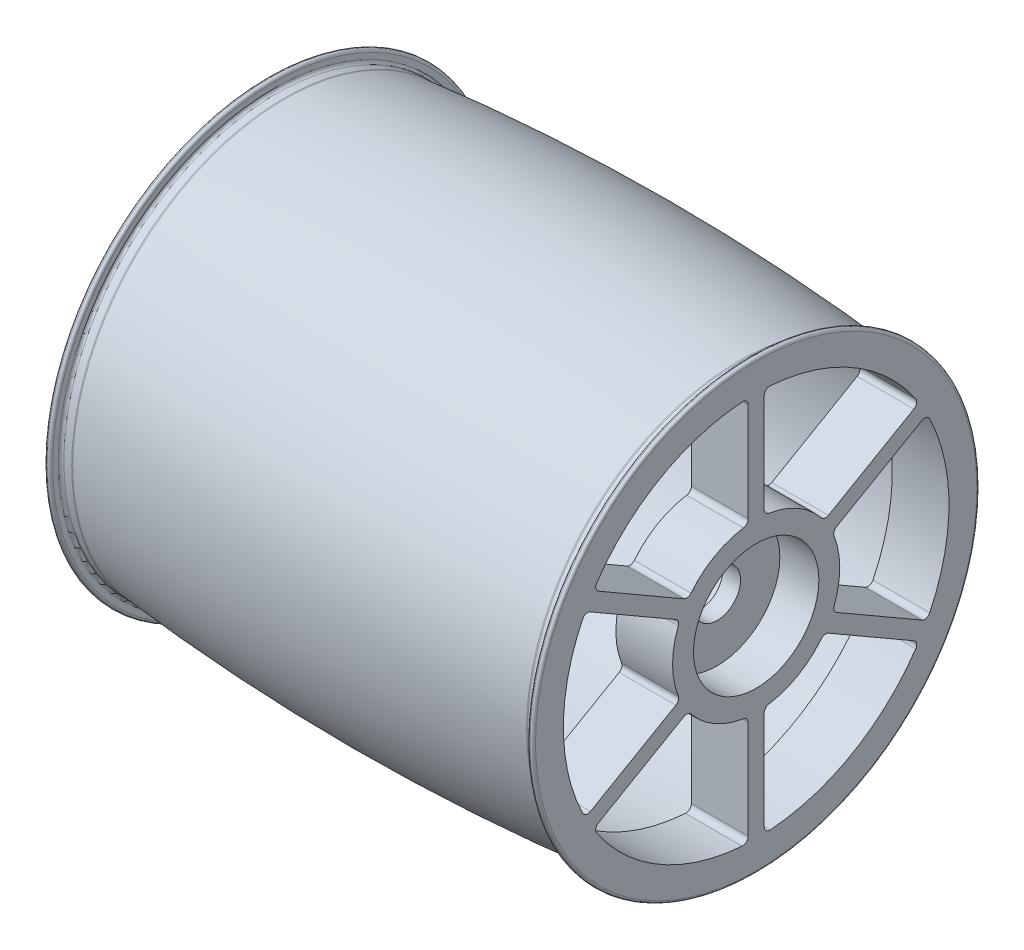
from build123d import *

# Parameters (mm, degrees)
FILLET2_R               = 2
FILLET1_R               = 0.5
CUT_EXTRUDE2_DEPTH      = 105.379293521
CUT_EXTRUDE5_DEPTH      = 105.379293521
CUT_EXTRUDE5_DEPTH_BACK = 105.379293521
SKETCH7_R               = 4.2
SKETCH8_R               = 11.25
CUT_EXTRUDE6_DEPTH      = 7


# Some blends are built 0.0001 mm under size
with BuildPart() as part:
    # Sketch1 → Revolve2 (revolve)
    with BuildSketch(Plane.XY, mode=Mode.PRIVATE) as revolve2_sk:
        with BuildLine():
            Line((-40.815, 38.1), (-42.815, 38.1))
            Line((-42.815, 38.1), (-42.815, 40.1))
            Line((-42.815, 40.1), (-43.815, 40.1))
            Line((-43.815, 40.1), (-43.815, 0))
            Line((-43.815, 0), (-33.64, 0))
            Line((-33.64, 0), (-33.64, 37.739142957))
            ThreePointArc((-33.64, 37.739142957), (0, 39.1), (33.64, 37.739142957))
            Line((33.64, 37.739142957), (33.64, 0))
            Line((33.64, 0), (43.815, 0))
            Line((43.815, 0), (43.815, 40.1))
            Line((43.815, 40.1), (42.815, 40.1))
            Line((42.815, 40.1), (42.815, 38.1))
            Line((42.815, 38.1), (40.815, 38.1))
            ThreePointArc((40.815, 38.1), (0, 40.1), (-40.815, 38.1))
        make_face()
    revolve(revolve2_sk.sketch.rotate(Axis((-40.815, 0, 0), (1, 0, 0)), 90), axis=Axis((-40.815, 0, 0), (1, 0, 0)))

    # Fillet2
    # the kernel refuses this fillet: 2 mm, written as the material it adds along each edge
    with BuildSketch(Plane(origin=(-33.64, 0, 0), x_dir=(0, 0, 1), z_dir=(0, 1, 0))) as fillet2_piece_1:
        with BuildLine():
            CenterArc((35.890549485, 2), FILLET2_R, 270, 85.621827551)
            ThreePointArc((37.884713299, 1.847321635), (37.812955576, 0.923579854), (37.739142957, 0))
            Line((37.739142957, 0), (35.890549485, 0))
        make_face()
    revolve(axis=Axis((-33.64, 0, 0), (1, 0, 0)))
    with BuildSketch(Plane(origin=(33.64, 0, 0), x_dir=(0, 0, 1), z_dir=(0, 1, 0))) as fillet2_piece_2:
        with BuildLine():
            CenterArc((35.890549485, -2), FILLET2_R, 4.378172449, 85.621827551)
            Line((35.890549485, 0), (37.739142957, 0))
            ThreePointArc((37.739142957, 0), (37.812955576, -0.923579854), (37.884713299, -1.847321635))
        make_face()
    revolve(axis=Axis((33.64, 0, 0), (1, 0, 0)))
    with BuildSketch(Plane(origin=(40.815, 0, 0), x_dir=(0, 0, 1), z_dir=(0, 1, 0))) as fillet2_piece_3:
        with BuildLine():
            CenterArc((40.1, 0.097885806), FILLET2_R, 180, 5.597278626)
            ThreePointArc((38.109535933, -0.097185452), (38.104770808, -0.048592447), (38.1, 0))
            Line((38.1, 0), (38.1, 0.097885806))
        make_face()
    revolve(axis=Axis((40.815, 0, 0), (1, 0, 0)))
    with BuildSketch(Plane(origin=(-40.815, 0, 0), x_dir=(0, 0, 1), z_dir=(0, 1, 0))) as fillet2_piece_4:
        with BuildLine():
            CenterArc((40.1, -0.097885806), FILLET2_R, 174.402721374, 5.597278626)
            Line((38.1, -0.097885806), (38.1, 0))
            ThreePointArc((38.1, 0), (38.104770808, 0.048592447), (38.109535933, 0.097185452))
        make_face()
    revolve(axis=Axis((-40.815, 0, 0), (1, 0, 0)))

    # Fillet1
    fillet1_edges = [part.edges().sort_by_distance(p)[0] for p in [
        (-42.815, 0, -40.1),
        (-43.815, 0, -40.1),
        (43.815, 0, -40.1),
        (42.815, 0, -40.1),
        (42.815, 0, -38.1),
        (-42.815, 0, -38.1),
    ]]
    fillet(fillet1_edges, radius=FILLET1_R - 0.0001)  # a hair under: the kernel refuses the full size

    # Sketch2 → Cut-Extrude2 (cut, through all)
    with BuildSketch(Plane.ZY.offset(43.815)):
        with BuildLine():
            Line((14.415571014, 6.656167139), (29.74310125, 15.505520846))
            ThreePointArc((29.74310125, 15.505520846), (30.536893025, 15.595364886), (31.143193549, 15.075194712))
            ThreePointArc((31.143193549, 15.075194712), (34.6, 0), (31.143193549, -15.075194712))
            ThreePointArc((31.143193549, -15.075194712), (30.536893025, -15.595364886), (29.74310125, -15.505520846))
            Line((29.74310125, -15.505520846), (14.415571014, -6.656167139))
            ThreePointArc((14.415571014, -6.656167139), (13.972302174, -6.122171697), (13.983347826, -5.428257877))
            ThreePointArc((13.983347826, -5.428257877), (15, 0), (13.983347826, 5.428257877))
            ThreePointArc((13.983347826, 5.428257877), (13.972302174, 6.122171697), (14.415571014, 6.656167139))
        make_face()
        with BuildLine():
            Line((12.972195341, -9.156167139), (28.299725577, -18.005520846))
            ThreePointArc((28.299725577, -18.005520846), (28.774428685, -18.64804267), (28.627098362, -19.433199412))
            ThreePointArc((28.627098362, -19.433199412), (17.3, -29.964478971), (2.516095187, -34.508394124))
            ThreePointArc((2.516095187, -34.508394124), (1.76246434, -34.243407555), (1.443375673, -33.511041693))
            Line((1.443375673, -33.511041693), (1.443375673, -15.812334278))
            ThreePointArc((1.443375673, -15.812334278), (1.684194871, -15.161454481), (2.290664693, -14.824063386))
            ThreePointArc((2.290664693, -14.824063386), (7.5, -12.990381057), (11.692683133, -9.395805509))
            ThreePointArc((11.692683133, -9.395805509), (12.288107303, -9.039282784), (12.972195341, -9.156167139))
        make_face()
        with BuildLine():
            Line((-1.443375673, -15.812334278), (-1.443375673, -33.511041693))
            ThreePointArc((-1.443375673, -33.511041693), (-1.76246434, -34.243407555), (-2.516095187, -34.508394124))
            ThreePointArc((-2.516095187, -34.508394124), (-17.3, -29.964478971), (-28.627098362, -19.433199412))
            ThreePointArc((-28.627098362, -19.433199412), (-28.774428685, -18.64804267), (-28.299725577, -18.005520846))
            Line((-28.299725577, -18.005520846), (-12.972195341, -9.156167139))
            ThreePointArc((-12.972195341, -9.156167139), (-12.288107303, -9.039282784), (-11.692683133, -9.395805509))
            ThreePointArc((-11.692683133, -9.395805509), (-7.5, -12.990381057), (-2.290664693, -14.824063386))
            ThreePointArc((-2.290664693, -14.824063386), (-1.684194871, -15.161454481), (-1.443375673, -15.812334278))
        make_face()
        with BuildLine():
            Line((-14.415571014, -6.656167139), (-29.74310125, -15.505520846))
            ThreePointArc((-29.74310125, -15.505520846), (-30.536893025, -15.595364886), (-31.143193549, -15.075194712))
            ThreePointArc((-31.143193549, -15.075194712), (-34.6, 0), (-31.143193549, 15.075194712))
            ThreePointArc((-31.143193549, 15.075194712), (-30.536893025, 15.595364886), (-29.74310125, 15.505520846))
            Line((-29.74310125, 15.505520846), (-14.415571014, 6.656167139))
            ThreePointArc((-14.415571014, 6.656167139), (-13.972302174, 6.122171697), (-13.983347826, 5.428257877))
            ThreePointArc((-13.983347826, 5.428257877), (-15, 0), (-13.983347826, -5.428257877))
            ThreePointArc((-13.983347826, -5.428257877), (-13.972302174, -6.122171697), (-14.415571014, -6.656167139))
        make_face()
        with BuildLine():
            Line((-12.972195341, 9.156167139), (-28.299725577, 18.005520846))
            ThreePointArc((-28.299725577, 18.005520846), (-28.774428685, 18.64804267), (-28.627098362, 19.433199412))
            ThreePointArc((-28.627098362, 19.433199412), (-17.3, 29.964478971), (-2.516095187, 34.508394124))
            ThreePointArc((-2.516095187, 34.508394124), (-1.76246434, 34.243407555), (-1.443375673, 33.511041693))
            Line((-1.443375673, 33.511041693), (-1.443375673, 15.812334278))
            ThreePointArc((-1.443375673, 15.812334278), (-1.684194871, 15.161454481), (-2.290664693, 14.824063386))
            ThreePointArc((-2.290664693, 14.824063386), (-7.5, 12.990381057), (-11.692683133, 9.395805509))
            ThreePointArc((-11.692683133, 9.395805509), (-12.288107303, 9.039282784), (-12.972195341, 9.156167139))
        make_face()
        with BuildLine():
            Line((1.443375673, 15.812334278), (1.443375673, 33.511041693))
            ThreePointArc((1.443375673, 33.511041693), (1.76246434, 34.243407555), (2.516095187, 34.508394124))
            ThreePointArc((2.516095187, 34.508394124), (17.3, 29.964478971), (28.627098362, 19.433199412))
            ThreePointArc((28.627098362, 19.433199412), (28.774428685, 18.64804267), (28.299725577, 18.005520846))
            Line((28.299725577, 18.005520846), (12.972195341, 9.156167139))
            ThreePointArc((12.972195341, 9.156167139), (12.288107303, 9.039282784), (11.692683133, 9.395805509))
            ThreePointArc((11.692683133, 9.395805509), (7.5, 12.990381057), (2.290664693, 14.824063386))
            ThreePointArc((2.290664693, 14.824063386), (1.684194871, 15.161454481), (1.443375673, 15.812334278))
        make_face()
    extrude(amount=-CUT_EXTRUDE2_DEPTH, mode=Mode.SUBTRACT)

    # Sketch7 → Cut-Extrude5 (cut, two sides: drawn at the far end of the back side and taken through both)
    with BuildSketch(Plane(origin=(43.815, 0, 0), x_dir=(0, 0, -1), z_dir=(1, 0, 0)).offset(-CUT_EXTRUDE5_DEPTH_BACK)):
        Circle(SKETCH7_R)
    extrude(amount=CUT_EXTRUDE5_DEPTH + CUT_EXTRUDE5_DEPTH_BACK, mode=Mode.SUBTRACT)

    # Sketch8 → Cut-Extrude6 (cut)
    with BuildSketch(Plane(origin=(43.815, 0, 0), x_dir=(0, 0, -1), z_dir=(1, 0, 0))):
        Circle(SKETCH8_R)
    cut_extrude6 = extrude(amount=-CUT_EXTRUDE6_DEPTH, mode=Mode.SUBTRACT)

    # Mirror1: Cut-Extrude6 across plane
    add(cut_extrude6.mirror(Plane(origin=(0, 0, 0), x_dir=(0, 0, 1), z_dir=(1, 0, 0))), mode=Mode.SUBTRACT)


solid = part.part
